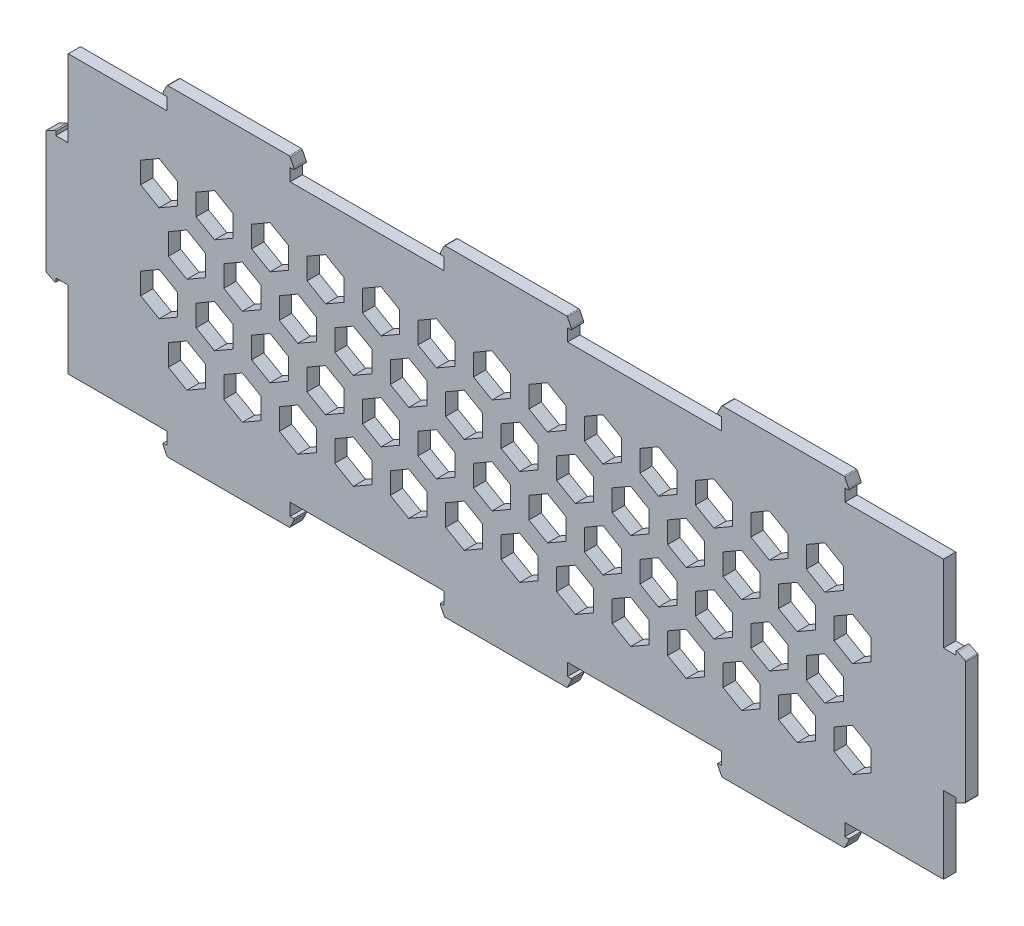
from build123d import *

# Parameters (mm, degrees)
BOSS_EXTRUDE1_DEPTH     = 2
ENL_V_MAT_EXTRU_1_DEPTH = 148.934343545


with BuildPart() as part:
    # Sketch1 → Boss-Extrude1 (new body)
    with BuildSketch(Plane.XY):
        with BuildLine():
            Line((0, 22.5), (0, 10))
            Line((0, 10), (-2, 10))
            Line((-2, 10), (-2, 10.6))
            ThreePointArc((-2, 10.6), (-2.15, 10.635410197), (-2.3, 10.6))
            Line((-2.3, 10.6), (-3.5, 10))
            ThreePointArc((-3.5, 10), (-3.572982477, 9.933302253), (-3.6, 9.838196601))
            Line((-3.6, 9.838196601), (-3.6, -9.838196601))
            ThreePointArc((-3.6, -9.838196601), (-3.572982477, -9.933302253), (-3.5, -10))
            Line((-3.5, -10), (-2.3, -10.6))
            ThreePointArc((-2.3, -10.6), (-2.15, -10.635410197), (-2, -10.6))
            Line((-2, -10.6), (-2, -10))
            Line((-2, -10), (0, -10))
            Line((0, -10), (0, -22.5))
            Line((0, -22.5), (16, -22.5))
            Line((16, -22.5), (16, -24.5))
            Line((16, -24.5), (15.4, -24.5))
            ThreePointArc((15.4, -24.5), (15.364589803, -24.65), (15.4, -24.8))
            Line((15.4, -24.8), (16, -26))
            ThreePointArc((16, -26), (16.066697747, -26.072982477), (16.161803399, -26.1))
            Line((16.161803399, -26.1), (35.838196601, -26.1))
            ThreePointArc((35.838196601, -26.1), (35.933302253, -26.072982477), (36, -26))
            Line((36, -26), (36.6, -24.8))
            ThreePointArc((36.6, -24.8), (36.635410197, -24.65), (36.6, -24.5))
            Line((36.6, -24.5), (36, -24.5))
            Line((36, -24.5), (36, -22.5))
            Line((36, -22.5), (61, -22.5))
            Line((61, -22.5), (61, -24.5))
            Line((61, -24.5), (60.4, -24.5))
            ThreePointArc((60.4, -24.5), (60.364589803, -24.65), (60.4, -24.8))
            Line((60.4, -24.8), (61, -26))
            ThreePointArc((61, -26), (61.066697747, -26.072982477), (61.161803399, -26.1))
            Line((61.161803399, -26.1), (80.838196601, -26.1))
            ThreePointArc((80.838196601, -26.1), (80.933302253, -26.072982477), (81, -26))
            Line((81, -26), (81.6, -24.8))
            ThreePointArc((81.6, -24.8), (81.635410197, -24.65), (81.6, -24.5))
            Line((81.6, -24.5), (81, -24.5))
            Line((81, -24.5), (81, -22.5))
            Line((81, -22.5), (106, -22.5))
            Line((106, -22.5), (106, -24.5))
            Line((106, -24.5), (105.4, -24.5))
            ThreePointArc((105.4, -24.5), (105.364589803, -24.65), (105.4, -24.8))
            Line((105.4, -24.8), (106, -26))
            ThreePointArc((106, -26), (106.066697747, -26.072982477), (106.161803399, -26.1))
            Line((106.161803399, -26.1), (125.838196601, -26.1))
            ThreePointArc((125.838196601, -26.1), (125.933302253, -26.072982477), (126, -26))
            Line((126, -26), (126.6, -24.8))
            ThreePointArc((126.6, -24.8), (126.635410197, -24.65), (126.6, -24.5))
            Line((126.6, -24.5), (126, -24.5))
            Line((126, -24.5), (126, -22.5))
            Line((126, -22.5), (142, -22.5))
            Line((142, -22.5), (142, -10))
            Line((142, -10), (144, -10))
            Line((144, -10), (144, -10.6))
            ThreePointArc((144, -10.6), (144.15, -10.635410197), (144.3, -10.6))
            Line((144.3, -10.6), (145.5, -10))
            ThreePointArc((145.5, -10), (145.572982477, -9.933302253), (145.6, -9.838196601))
            Line((145.6, -9.838196601), (145.6, 9.838196601))
            ThreePointArc((145.6, 9.838196601), (145.572982477, 9.933302253), (145.5, 10))
            Line((145.5, 10), (144.3, 10.6))
            ThreePointArc((144.3, 10.6), (144.15, 10.635410197), (144, 10.6))
            Line((144, 10.6), (144, 10))
            Line((144, 10), (142, 10))
            Line((142, 10), (142, 22.5))
            Line((142, 22.5), (126, 22.5))
            Line((126, 22.5), (126, 24.5))
            Line((126, 24.5), (126.6, 24.5))
            ThreePointArc((126.6, 24.5), (126.635410197, 24.65), (126.6, 24.8))
            Line((126.6, 24.8), (126, 26))
            ThreePointArc((126, 26), (125.933302253, 26.072982477), (125.838196601, 26.1))
            Line((125.838196601, 26.1), (106.161803399, 26.1))
            ThreePointArc((106.161803399, 26.1), (106.066697747, 26.072982477), (106, 26))
            Line((106, 26), (105.4, 24.8))
            ThreePointArc((105.4, 24.8), (105.364589803, 24.65), (105.4, 24.5))
            Line((105.4, 24.5), (106, 24.5))
            Line((106, 24.5), (106, 22.5))
            Line((106, 22.5), (81, 22.5))
            Line((81, 22.5), (81, 24.5))
            Line((81, 24.5), (81.6, 24.5))
            ThreePointArc((81.6, 24.5), (81.635410197, 24.65), (81.6, 24.8))
            Line((81.6, 24.8), (81, 26))
            ThreePointArc((81, 26), (80.933302253, 26.072982477), (80.838196601, 26.1))
            Line((80.838196601, 26.1), (61.161803399, 26.1))
            ThreePointArc((61.161803399, 26.1), (61.066697747, 26.072982477), (61, 26))
            Line((61, 26), (60.4, 24.8))
            ThreePointArc((60.4, 24.8), (60.364589803, 24.65), (60.4, 24.5))
            Line((60.4, 24.5), (61, 24.5))
            Line((61, 24.5), (61, 22.5))
            Line((61, 22.5), (36, 22.5))
            Line((36, 22.5), (36, 24.5))
            Line((36, 24.5), (36.6, 24.5))
            ThreePointArc((36.6, 24.5), (36.635410197, 24.65), (36.6, 24.8))
            Line((36.6, 24.8), (36, 26))
            ThreePointArc((36, 26), (35.933302253, 26.072982477), (35.838196601, 26.1))
            Line((35.838196601, 26.1), (16.161803399, 26.1))
            ThreePointArc((16.161803399, 26.1), (16.066697747, 26.072982477), (16, 26))
            Line((16, 26), (15.4, 24.8))
            ThreePointArc((15.4, 24.8), (15.364589803, 24.65), (15.4, 24.5))
            Line((15.4, 24.5), (16, 24.5))
            Line((16, 24.5), (16, 22.5))
            Line((16, 22.5), (0, 22.5))
        make_face()
    extrude(amount=BOSS_EXTRUDE1_DEPTH)

    # Esquisse1 → Enlèv. mat.-Extru.1 (cut, through all)
    with BuildSketch(Plane.XY.offset(2)):
        Polygon((11.75, 9.959292144), (14.75, 8.227241336), (17.75, 9.959292144), (17.75, 13.423393759), (14.75, 15.155444566), (11.75, 13.423393759), align=None)
        Polygon((22.25, 5.629165125), (19.25, 7.361215932), (16.25, 5.629165125), (16.25, 2.165063509), (19.25, 0.433012702), (22.25, 2.165063509), align=None)
        Polygon((20.75, 13.423393759), (20.75, 9.959292144), (23.75, 8.227241336), (26.75, 9.959292144), (26.75, 13.423393759), (23.75, 15.155444566), align=None)
        Polygon((31.25, 5.629165125), (28.25, 7.361215932), (25.25, 5.629165125), (25.25, 2.165063509), (28.25, 0.433012702), (31.25, 2.165063509), align=None)
        Polygon((35.75, 13.423393759), (32.75, 15.155444566), (29.75, 13.423393759), (29.75, 9.959292144), (32.75, 8.227241336), (35.75, 9.959292144), align=None)
        Polygon((40.25, 5.629165125), (37.25, 7.361215932), (34.25, 5.629165125), (34.25, 2.165063509), (37.25, 0.433012702), (40.25, 2.165063509), align=None)
        Polygon((44.75, 13.423393759), (41.75, 15.155444566), (38.75, 13.423393759), (38.75, 9.959292144), (41.75, 8.227241336), (44.75, 9.959292144), align=None)
        Polygon((47.75, 13.423393759), (47.75, 9.959292144), (50.75, 8.227241336), (53.75, 9.959292144), (53.75, 13.423393759), (50.75, 15.155444566), align=None)
        Polygon((58.25, 5.629165125), (55.25, 7.361215932), (52.25, 5.629165125), (52.25, 2.165063509), (55.25, 0.433012702), (58.25, 2.165063509), align=None)
        Polygon((62.75, 13.423393759), (59.75, 15.155444566), (56.75, 13.423393759), (56.75, 9.959292144), (59.75, 8.227241336), (62.75, 9.959292144), align=None)
        Polygon((67.25, 5.629165125), (64.25, 7.361215932), (61.25, 5.629165125), (61.25, 2.165063509), (64.25, 0.433012702), (67.25, 2.165063509), align=None)
        Polygon((71.75, 13.423393759), (68.75, 15.155444566), (65.75, 13.423393759), (65.75, 9.959292144), (68.75, 8.227241336), (71.75, 9.959292144), align=None)
        Polygon((43.25, 2.165063509), (46.25, 0.433012702), (49.25, 2.165063509), (49.25, 5.629165125), (46.25, 7.361215932), (43.25, 5.629165125), align=None)
        Polygon((11.75, -5.629165125), (14.75, -7.361215932), (17.75, -5.629165125), (17.75, -2.165063509), (14.75, -0.433012702), (11.75, -2.165063509), align=None)
        Polygon((22.25, -9.959292144), (19.25, -8.227241336), (16.25, -9.959292144), (16.25, -13.423393759), (19.25, -15.155444566), (22.25, -13.423393759), align=None)
        Polygon((20.75, -2.165063509), (20.75, -5.629165125), (23.75, -7.361215932), (26.75, -5.629165125), (26.75, -2.165063509), (23.75, -0.433012702), align=None)
        Polygon((31.25, -9.959292144), (28.25, -8.227241336), (25.25, -9.959292144), (25.25, -13.423393759), (28.25, -15.155444566), (31.25, -13.423393759), align=None)
        Polygon((35.75, -2.165063509), (32.75, -0.433012702), (29.75, -2.165063509), (29.75, -5.629165125), (32.75, -7.361215932), (35.75, -5.629165125), align=None)
        Polygon((40.25, -9.959292144), (37.25, -8.227241336), (34.25, -9.959292144), (34.25, -13.423393759), (37.25, -15.155444566), (40.25, -13.423393759), align=None)
        Polygon((44.75, -2.165063509), (41.75, -0.433012702), (38.75, -2.165063509), (38.75, -5.629165125), (41.75, -7.361215932), (44.75, -5.629165125), align=None)
        Polygon((47.75, -2.165063509), (47.75, -5.629165125), (50.75, -7.361215932), (53.75, -5.629165125), (53.75, -2.165063509), (50.75, -0.433012702), align=None)
        Polygon((58.25, -9.959292144), (55.25, -8.227241336), (52.25, -9.959292144), (52.25, -13.423393759), (55.25, -15.155444566), (58.25, -13.423393759), align=None)
        Polygon((62.75, -2.165063509), (59.75, -0.433012702), (56.75, -2.165063509), (56.75, -5.629165125), (59.75, -7.361215932), (62.75, -5.629165125), align=None)
        Polygon((67.25, -9.959292144), (64.25, -8.227241336), (61.25, -9.959292144), (61.25, -13.423393759), (64.25, -15.155444566), (67.25, -13.423393759), align=None)
        Polygon((71.75, -2.165063509), (68.75, -0.433012702), (65.75, -2.165063509), (65.75, -5.629165125), (68.75, -7.361215932), (71.75, -5.629165125), align=None)
        Polygon((43.25, -13.423393759), (46.25, -15.155444566), (49.25, -13.423393759), (49.25, -9.959292144), (46.25, -8.227241336), (43.25, -9.959292144), align=None)
        Polygon((130.25, -9.959292144), (127.25, -8.227241336), (124.25, -9.959292144), (124.25, -13.423393759), (127.25, -15.155444566), (130.25, -13.423393759), align=None)
        Polygon((119.75, -5.629165125), (122.75, -7.361215932), (125.75, -5.629165125), (125.75, -2.165063509), (122.75, -0.433012702), (119.75, -2.165063509), align=None)
        Polygon((121.25, -13.423393759), (121.25, -9.959292144), (118.25, -8.227241336), (115.25, -9.959292144), (115.25, -13.423393759), (118.25, -15.155444566), align=None)
        Polygon((110.75, -5.629165125), (113.75, -7.361215932), (116.75, -5.629165125), (116.75, -2.165063509), (113.75, -0.433012702), (110.75, -2.165063509), align=None)
        Polygon((106.25, -13.423393759), (109.25, -15.155444566), (112.25, -13.423393759), (112.25, -9.959292144), (109.25, -8.227241336), (106.25, -9.959292144), align=None)
        Polygon((101.75, -5.629165125), (104.75, -7.361215932), (107.75, -5.629165125), (107.75, -2.165063509), (104.75, -0.433012702), (101.75, -2.165063509), align=None)
        Polygon((97.25, -13.423393759), (100.25, -15.155444566), (103.25, -13.423393759), (103.25, -9.959292144), (100.25, -8.227241336), (97.25, -9.959292144), align=None)
        Polygon((94.25, -13.423393759), (94.25, -9.959292144), (91.25, -8.227241336), (88.25, -9.959292144), (88.25, -13.423393759), (91.25, -15.155444566), align=None)
        Polygon((83.75, -5.629165125), (86.75, -7.361215932), (89.75, -5.629165125), (89.75, -2.165063509), (86.75, -0.433012702), (83.75, -2.165063509), align=None)
        Polygon((79.25, -13.423393759), (82.25, -15.155444566), (85.25, -13.423393759), (85.25, -9.959292144), (82.25, -8.227241336), (79.25, -9.959292144), align=None)
        Polygon((74.75, -5.629165125), (77.75, -7.361215932), (80.75, -5.629165125), (80.75, -2.165063509), (77.75, -0.433012702), (74.75, -2.165063509), align=None)
        Polygon((70.25, -13.423393759), (73.25, -15.155444566), (76.25, -13.423393759), (76.25, -9.959292144), (73.25, -8.227241336), (70.25, -9.959292144), align=None)
        Polygon((98.75, -2.165063509), (95.75, -0.433012702), (92.75, -2.165063509), (92.75, -5.629165125), (95.75, -7.361215932), (98.75, -5.629165125), align=None)
        Polygon((130.25, 5.629165125), (127.25, 7.361215932), (124.25, 5.629165125), (124.25, 2.165063509), (127.25, 0.433012702), (130.25, 2.165063509), align=None)
        Polygon((119.75, 9.959292144), (122.75, 8.227241336), (125.75, 9.959292144), (125.75, 13.423393759), (122.75, 15.155444566), (119.75, 13.423393759), align=None)
        Polygon((121.25, 2.165063509), (121.25, 5.629165125), (118.25, 7.361215932), (115.25, 5.629165125), (115.25, 2.165063509), (118.25, 0.433012702), align=None)
        Polygon((110.75, 9.959292144), (113.75, 8.227241336), (116.75, 9.959292144), (116.75, 13.423393759), (113.75, 15.155444566), (110.75, 13.423393759), align=None)
        Polygon((106.25, 2.165063509), (109.25, 0.433012702), (112.25, 2.165063509), (112.25, 5.629165125), (109.25, 7.361215932), (106.25, 5.629165125), align=None)
        Polygon((101.75, 9.959292144), (104.75, 8.227241336), (107.75, 9.959292144), (107.75, 13.423393759), (104.75, 15.155444566), (101.75, 13.423393759), align=None)
        Polygon((97.25, 2.165063509), (100.25, 0.433012702), (103.25, 2.165063509), (103.25, 5.629165125), (100.25, 7.361215932), (97.25, 5.629165125), align=None)
        Polygon((94.25, 2.165063509), (94.25, 5.629165125), (91.25, 7.361215932), (88.25, 5.629165125), (88.25, 2.165063509), (91.25, 0.433012702), align=None)
        Polygon((83.75, 9.959292144), (86.75, 8.227241336), (89.75, 9.959292144), (89.75, 13.423393759), (86.75, 15.155444566), (83.75, 13.423393759), align=None)
        Polygon((79.25, 2.165063509), (82.25, 0.433012702), (85.25, 2.165063509), (85.25, 5.629165125), (82.25, 7.361215932), (79.25, 5.629165125), align=None)
        Polygon((74.75, 9.959292144), (77.75, 8.227241336), (80.75, 9.959292144), (80.75, 13.423393759), (77.75, 15.155444566), (74.75, 13.423393759), align=None)
        Polygon((70.25, 2.165063509), (73.25, 0.433012702), (76.25, 2.165063509), (76.25, 5.629165125), (73.25, 7.361215932), (70.25, 5.629165125), align=None)
        Polygon((98.75, 13.423393759), (95.75, 15.155444566), (92.75, 13.423393759), (92.75, 9.959292144), (95.75, 8.227241336), (98.75, 9.959292144), align=None)
    extrude(amount=-ENL_V_MAT_EXTRU_1_DEPTH, mode=Mode.SUBTRACT)


solid = part.part
